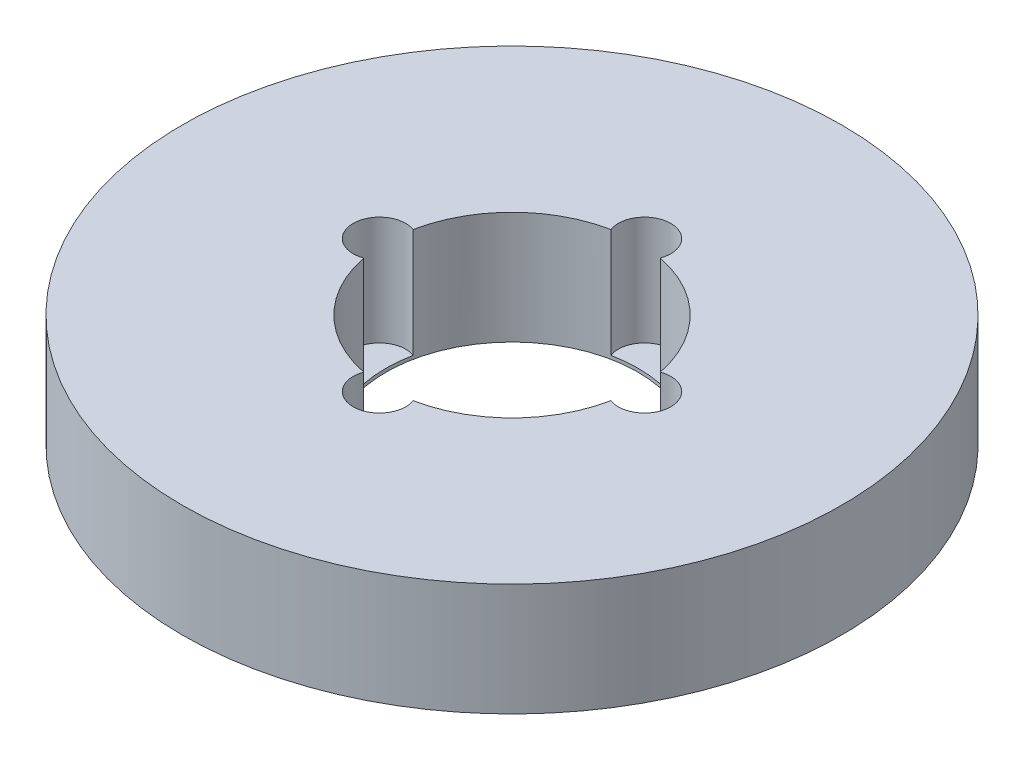
from build123d import *

# Parameters (mm, degrees)
SKETCH1_R           = 85
BOSS_EXTRUDE1_DEPTH = 29
SKETCH2_R           = 32.5
CUT_EXTRUDE1_DEPTH  = 124.656783073
SKETCH3_R           = 6.783430658
CUT_EXTRUDE2_DEPTH  = 28.110819936
CIRPATTERN1_COUNT   = 4


with BuildPart() as part:
    # Sketch1 → Boss-Extrude1 (new body)
    with BuildSketch(Plane(origin=(0, 0, 0), x_dir=(1, 0, 0), z_dir=(0, 1, 0))):
        Circle(SKETCH1_R)
    extrude(amount=BOSS_EXTRUDE1_DEPTH)

    # Sketch2 → Cut-Extrude1 (cut, through all)
    with BuildSketch(Plane(origin=(0, 0, 0), x_dir=(1, 0, 0), z_dir=(0, 1, 0))):
        Circle(SKETCH2_R)
    extrude(amount=CUT_EXTRUDE1_DEPTH, mode=Mode.SUBTRACT)

    # Sketch3 → Cut-Extrude2 (cut)
    with BuildSketch(Plane(origin=(0, 29, 0), x_dir=(1, 0, 0), z_dir=(0, 1, 0))):
        with Locations((-34.180322461, 0)):
            Circle(SKETCH3_R)
    cut_extrude2 = extrude(amount=-CUT_EXTRUDE2_DEPTH, mode=Mode.SUBTRACT)

    # CirPattern1: Cut-Extrude2 ×4 about axis
    cirpattern1_axis = Axis((0, 0, 0), (0, 1, 0))
    for i in range(1, CIRPATTERN1_COUNT):
        add(cut_extrude2.rotate(cirpattern1_axis, i * 360 / CIRPATTERN1_COUNT), mode=Mode.SUBTRACT)


solid = part.part
